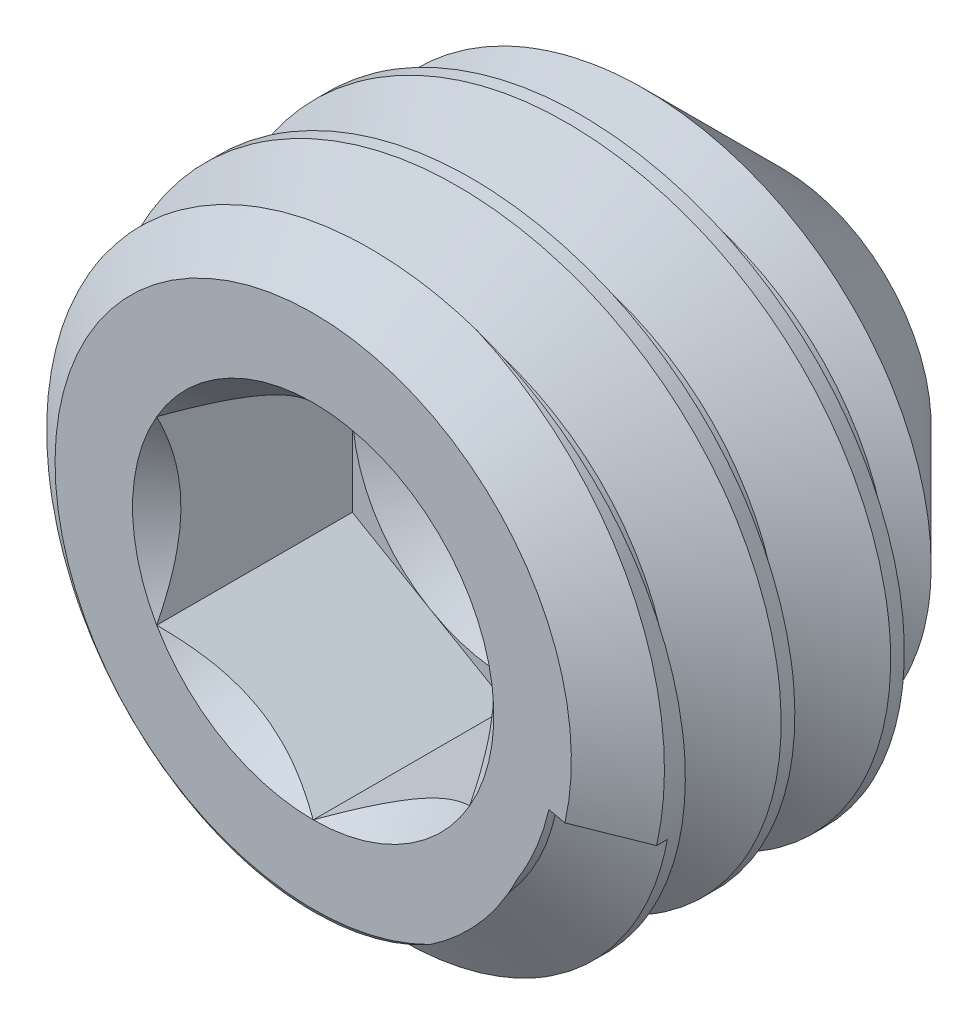
from build123d import *

# Parameters (mm, degrees)
CUT_EXTRUDE1_DEPTH = 1.25
CUT_SWEEP1_PITCH   = 0.7


with BuildPart() as part:
    # Sketch11 → Revolve1 (revolve)
    with BuildSketch(Plane(origin=(0, 0, 0), x_dir=(0, 0, -1), z_dir=(1, 0, 0)), mode=Mode.PRIVATE) as revolve1_sk:
        Polygon((-1.5, 0), (-1.5, 1.65), (-1.254927362, 2), (0.45, 2), (1.5, 0.95), (0.929182412, 0), align=None)
    revolve(revolve1_sk.sketch.rotate(Axis((0, 0, -0.929182412), (0, 0, -1)), 180), axis=Axis((0, 0, -0.929182412), (0, 0, -1)))

    # Sketch2 → Cut-Extrude1 (cut)
    with BuildSketch(Plane.XY.offset(1.5)):
        Polygon((0, 1.154700538), (-1, 0.577350269), (-1, -0.577350269), (0, -1.154700538), (1, -0.577350269), (1, 0.577350269), align=None)
    extrude(amount=-CUT_EXTRUDE1_DEPTH, mode=Mode.SUBTRACT)

    # Cut-Extrude2 cone 1 section (through the dimple's axis) → Cut-Extrude2 (revolve, cut)
    with BuildSketch(Plane(origin=(0, 0, 1.5), x_dir=(0, -1, 0), z_dir=(1, 0, 0))):
        Polygon((0, 0), (1.154700538, 0), (0, 1.154700538), align=None)
    revolve(axis=Axis((0, 0, 1.5), (0, 0, -1)), mode=Mode.SUBTRACT)

    # Cut-Extrude3 cone 1 section (through the dimple's axis) → Cut-Extrude3 (revolve, cut)
    with BuildSketch(Plane(origin=(0, 0, 0.25), x_dir=(0, -1, 0), z_dir=(1, 0, 0))):
        Polygon((0, 0), (1, 0), (0, 0.577350269), align=None)
    revolve(axis=Axis((0, 0, 0.25), (0, 0, -1)), mode=Mode.SUBTRACT)

    # Cut-Sweep1: the profile of Sketch6 screwed along a right-hand helix of 4.714286 turns, 6 arcs to a turn; built about Z, then put on its axis
    cut_sweep1_z = Axis((0, 0, 0), (0, 0, 1))
    cut_sweep1_corners = [(2.037888611, 0, 0.021875), (2.037888611, 0, -0.634375), (1.545336663, 0, -0.35), (1.545336663, 0, -0.2625)]
    with BuildLine(mode=Mode.PRIVATE) as cut_sweep1_profile:
        Line(cut_sweep1_corners[0], cut_sweep1_corners[1])
        Line(cut_sweep1_corners[1], cut_sweep1_corners[2])
        Line(cut_sweep1_corners[2], cut_sweep1_corners[3])
        Line(cut_sweep1_corners[3], cut_sweep1_corners[0])
    cut_sweep1_cap = Face(cut_sweep1_profile.wire())
    cut_sweep1_turn_angles = [0, 30, 60, 90, 120, 150, 180, 210, 240, 270, 300, 330, 360]
    cut_sweep1_turn_weights = [1, 0.8660254037844387, 1, 0.8660254037844387, 1, 0.8660254037844387, 1, 0.8660254037844387, 1, 0.8660254037844387, 1, 0.8660254037844387, 1]
    cut_sweep1_turn_rails = [Edge.make_bspline([Vector(p[0], p[1], 0).rotate(cut_sweep1_z, cut_sweep1_turn_angles[k]) / cut_sweep1_turn_weights[k] + Vector(0, 0, p[2] + CUT_SWEEP1_PITCH * cut_sweep1_turn_angles[k] / 360) for k in range(13)], [0, 0, 0, 1, 1, 2, 2, 3, 3, 4, 4, 5, 5, 6, 6, 6], 2, cut_sweep1_turn_weights) for p in cut_sweep1_corners]
    cut_sweep1_turn_sides = [Face.make_surface_from_curves(cut_sweep1_turn_rails[p[0]], cut_sweep1_turn_rails[p[1]]) for p in [(0, 1), (1, 2), (2, 3), (3, 0)]]
    cut_sweep1_last_angles = [1440, 1470, 1500, 1530, 1560, 1590, 1620, 1650, 1680, 1688.571428571, 1697.142857143]
    cut_sweep1_last_weights = [1, 0.8660254037844387, 1, 0.8660254037844387, 1, 0.8660254037844387, 1, 0.8660254037844387, 1, 0.9888308262251233, 1]
    cut_sweep1_last_rails = [Edge.make_bspline([Vector(p[0], p[1], 0).rotate(cut_sweep1_z, cut_sweep1_last_angles[k]) / cut_sweep1_last_weights[k] + Vector(0, 0, p[2] + CUT_SWEEP1_PITCH * cut_sweep1_last_angles[k] / 360) for k in range(11)], [0, 0, 0, 1, 1, 2, 2, 3, 3, 4, 4, 5, 5, 5], 2, cut_sweep1_last_weights) for p in cut_sweep1_corners]
    cut_sweep1_last_sides = [Face.make_surface_from_curves(cut_sweep1_last_rails[p[0]], cut_sweep1_last_rails[p[1]]) for p in [(0, 1), (1, 2), (2, 3), (3, 0)]]
    cut_sweep1 = Plane(origin=(0, 0, -1.5), x_dir=(0, 1, 0), z_dir=(0, 0, 1)) * Solid(Shell([*[p.moved(Location((0, 0, CUT_SWEEP1_PITCH * i))) for i in range(4) for p in cut_sweep1_turn_sides], *cut_sweep1_last_sides, cut_sweep1_cap, cut_sweep1_cap.rotate(cut_sweep1_z, 1697.142857143).moved(Location((0, 0, CUT_SWEEP1_PITCH * 1697.142857143 / 360)))]))
    add(cut_sweep1, mode=Mode.SUBTRACT)


solid = part.part
